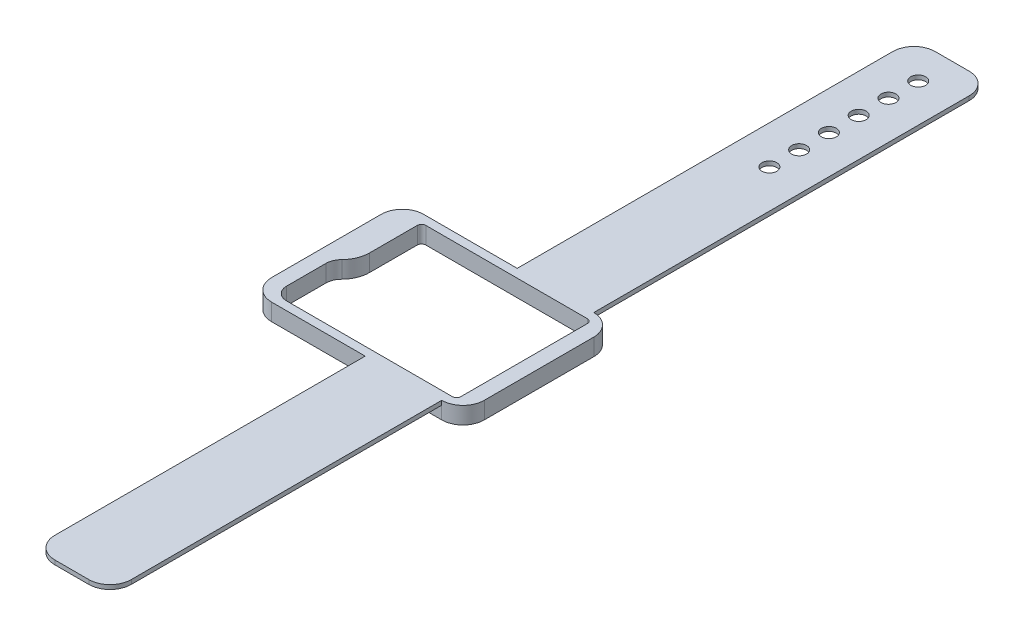
from build123d import *

# Parameters (mm, degrees)
SKETCH1_R           = 1.75
BOSS_EXTRUDE1_DEPTH = 1
FILLET1_R           = 5
BOSS_EXTRUDE2_START = 3
SKETCH2_W           = 50
SKETCH2_H           = 35.75
BOSS_EXTRUDE2_DEPTH = 3
FILLET3_R           = 1
SKETCH4_R           = 1.5
BOSS_EXTRUDE3_DEPTH = 2.5
BOSS_EXTRUDE4_START = -1
SKETCH5_R           = 1.75
BOSS_EXTRUDE4_DEPTH = 1
FILLET8_R           = 5


with BuildPart() as part:
    # Sketch1 → Boss-Extrude1 (new body)
    with BuildSketch(Plane(origin=(0, 0, 0), x_dir=(1, 0, 0), z_dir=(0, 1, 0))):
        Polygon((-27, 2), (0, 2), (0, 95.3), (18, 95.3), (18, 2), (23, 2), (23, -33.75), (18, -33.75), (18, -111.75), (0, -111.75), (0, -33.75), (-27, -33.75), align=None)
        with Locations(Location((9, -103.75, 0), (0, 0, 270))):
            Circle(SKETCH1_R, mode=Mode.SUBTRACT)
        with Locations(Location((9, 87.3, 0), (0, 0, 270))):
            Circle(SKETCH1_R, mode=Mode.SUBTRACT)
        with Locations(Location((9, 80.3, 0), (0, 0, 270))):
            Circle(SKETCH1_R, mode=Mode.SUBTRACT)
        with Locations(Location((9, 73.3, 0), (0, 0, 270))):
            Circle(SKETCH1_R, mode=Mode.SUBTRACT)
        with Locations(Location((9, 66.3, 0), (0, 0, 270))):
            Circle(SKETCH1_R, mode=Mode.SUBTRACT)
        with Locations(Location((9, 59.3, 0), (0, 0, 270))):
            Circle(SKETCH1_R, mode=Mode.SUBTRACT)
        with Locations(Location((9, 52.3, 0), (0, 0, 270))):
            Circle(SKETCH1_R, mode=Mode.SUBTRACT)
        with BuildLine():
            Line((-23.5, -28.75), (-23.5, -19.49269966))
            ThreePointArc((-23.5, -19.49269966), (-23.215880477, -18.058623358), (-22.406445692, -16.841202283))
            ThreePointArc((-22.406445692, -16.841202283), (-20.995319195, -14.718813714), (-20.5, -12.218719692))
            Line((-20.5, -12.218719692), (-20.5, 0))
            Line((-20.5, 0), (19.5, 0))
            Line((19.5, 0), (19.5, -31.75))
            Line((19.5, -31.75), (-20.5, -31.75))
            ThreePointArc((-20.5, -31.75), (-22.621320344, -30.871320344), (-23.5, -28.75))
        make_face(mode=Mode.SUBTRACT)
    extrude(amount=BOSS_EXTRUDE1_DEPTH)

    # Fillet1
    fillet1_edges = [part.edges().sort_by_distance(p)[0] for p in [
        (18, 0.5, 111.75),
        (0, 0.5, 111.75),
        (0, 0.5, -95.3),
        (18, 0.5, -95.3),
    ]]
    fillet(fillet1_edges, radius=FILLET1_R)

    # Sketch2 → Boss-Extrude2 (add)
    with BuildSketch(Plane.XZ.offset(BOSS_EXTRUDE2_START)):
        with Locations((-2, 15.875)):
            Rectangle(SKETCH2_W, SKETCH2_H)
        with BuildLine():
            ThreePointArc((-22.406445692, 16.841202283), (-23.215880477, 18.058623358), (-23.5, 19.49269966))
            Line((-23.5, 19.49269966), (-23.5, 28.75))
            ThreePointArc((-23.5, 28.75), (-22.621320344, 30.871320344), (-20.5, 31.75))
            Line((-20.5, 31.75), (19.5, 31.75))
            Line((19.5, 31.75), (19.5, 0))
            Line((19.5, 0), (-20.5, 0))
            Line((-20.5, 0), (-20.5, 12.218719692))
            ThreePointArc((-20.5, 12.218719692), (-20.995319195, 14.718813714), (-22.406445692, 16.841202283))
        make_face(mode=Mode.SUBTRACT)
    extrude(amount=-BOSS_EXTRUDE2_DEPTH)

    # Fillet3
    fillet3_edges = [part.edges().sort_by_distance(p)[0] for p in [
        (-20.5, -1, 0),
        (19.5, -1, 31.75),
        (19.5, -1, 0),
    ]]
    fillet(fillet3_edges, radius=FILLET3_R)



with BuildPart() as body_2:
    # Sketch4 → Boss-Extrude3 (new body)
    with BuildSketch(Plane(origin=(0, 1, 0), x_dir=(1, 0, 0), z_dir=(0, 1, 0))):
        with Locations(Location((9, -103.75, 0), (0, 0, 270))):
            Circle(SKETCH4_R)
    extrude(amount=-BOSS_EXTRUDE3_DEPTH)


with BuildPart() as part_1:
    add(part.part)

    add(body_2.part)  # Boss-Extrude4 merges body 2
    # Sketch5 → Boss-Extrude4 (add)
    with BuildSketch(Plane(origin=(0, 1, 0), x_dir=(1, 0, 0), z_dir=(0, 1, 0)).offset(BOSS_EXTRUDE4_START)):
        with Locations((9, -103.75)):
            Circle(SKETCH5_R)
    extrude(amount=BOSS_EXTRUDE4_DEPTH)

    # Fillet8
    fillet8_edges = [part_1.edges().sort_by_distance(p)[0] for p in [
        (23, -1, -2),
        (23, -1, 33.75),
        (-27, -1, 33.75),
        (-27, -1, -2),
    ]]
    fillet(fillet8_edges, radius=FILLET8_R - 0.0001)  # a hair under: the kernel refuses the full size


solid = part_1.part
